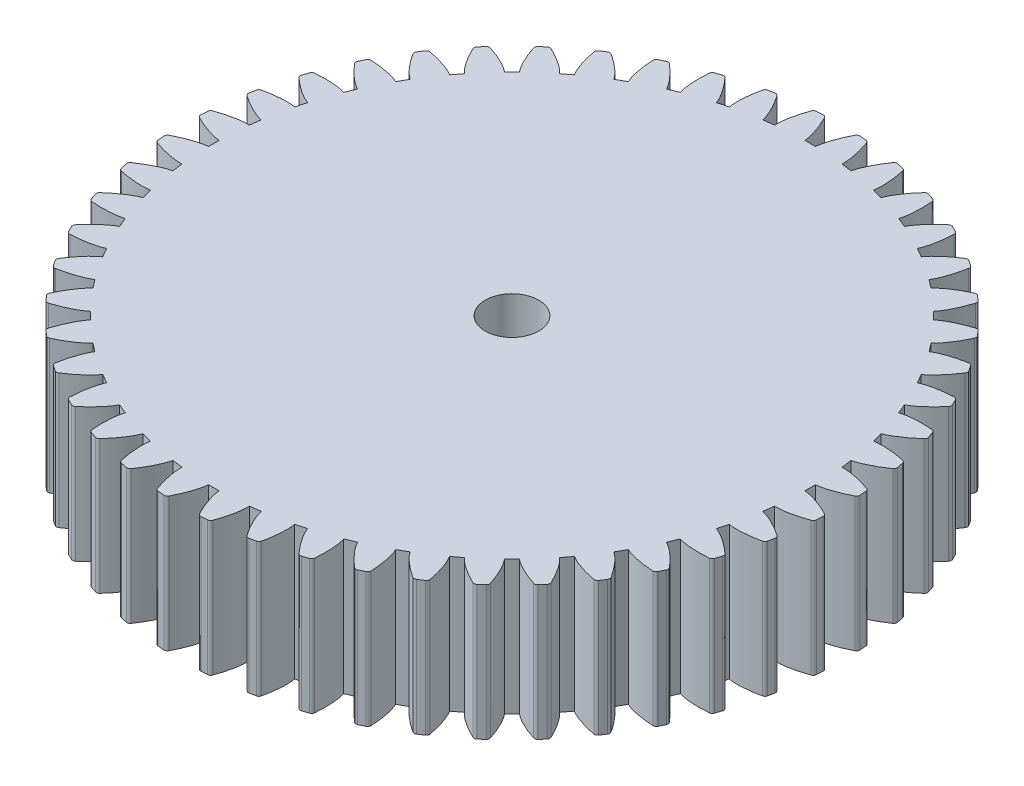
from build123d import *

# Parameters (mm, degrees)
SKETCH1_R                = 25.019
BOSS_EXTRUDE1_DEPTH      = 10.16
SKETCH2_R                = 2.032
CUT_EXTRUDE1_DEPTH       = 37.812040449
CUT_EXTRUDE2_DEPTH       = 37.812040449
FILLET1_R                = 0.254
CIRPATTERN1_COUNT        = 48
FILLET1_OF_CIRPATTERN1_R = 0.254


with BuildPart() as part:
    # Sketch1 → Boss-Extrude1 (new body)
    with BuildSketch(Plane(origin=(0, 0, 0), x_dir=(1, 0, 0), z_dir=(0, 1, 0))):
        Circle(SKETCH1_R)
    extrude(amount=BOSS_EXTRUDE1_DEPTH)

    # Sketch2 → Cut-Extrude1 (cut, through all)
    with BuildSketch(Plane(origin=(0, 10.16, 0), x_dir=(1, 0, 0), z_dir=(0, 1, 0))):
        Circle(SKETCH2_R)
    extrude(amount=-CUT_EXTRUDE1_DEPTH, mode=Mode.SUBTRACT)

    # Sketch3 → Cut-Extrude2 (cut, through all)
    with BuildSketch(Plane(origin=(0, 10.16, 0), x_dir=(1, 0, 0), z_dir=(0, 1, 0))):
        with BuildLine():
            Line((25.022135883, 1.25021561), (25.022135883, -1.25021561))
            add(Edge.make_bspline(
                [(22.602410583, -0.402829796), (22.606224346, -0.402936379), (22.616918633, -0.403354885), (22.637127056, -0.404618301), (22.670086825, -0.407350732), (22.712058202, -0.411818663), (22.766274811, -0.41872655), (22.830096935, -0.4283219), (22.900182603, -0.440394694), (22.976369557, -0.455178964), (23.052316043, -0.471387574), (23.128014647, -0.488915253), (23.203363021, -0.507601354), (23.294558326, -0.531685556), (23.40380098, -0.562579593), (23.531315684, -0.601627487), (23.675721078, -0.649381289), (23.822648625, -0.701761924), (23.967016654, -0.756354714), (24.112625727, -0.815023958), (24.253328245, -0.87427663), (24.399197404, -0.939422303), (24.533700679, -1.00138511), (24.684069967, -1.074794229), (24.805325575, -1.135199713), (24.930302693, -1.200927184), (24.991088327, -1.233408539), (25.022135883, -1.25021561)],
                knots=[0, 0, 0, 0, 0, 0.005376749, 0.015083688, 0.02853182, 0.04661014, 0.064854849, 0.092110526, 0.119476176, 0.146842496, 0.174208854, 0.201574956, 0.228941013, 0.256307345, 0.307035032, 0.361767352, 0.416499661, 0.471231937, 0.525964282, 0.580696616, 0.635428982, 0.690161387, 0.744893688, 0.799626082, 0.854358407, 0.909090914, 0.909090914, 0.909090914, 0.909090914, 0.909090914], degree=4))
            ThreePointArc((22.602410583, -0.402829796), (22.606, 0), (22.602410583, 0.402829796))
            add(Edge.make_bspline(
                [(22.602410583, 0.402829796), (22.606224346, 0.402936379), (22.616918633, 0.403354885), (22.637127056, 0.404618301), (22.670086825, 0.407350732), (22.712058202, 0.411818663), (22.766274811, 0.41872655), (22.830096935, 0.4283219), (22.900182603, 0.440394694), (22.976369557, 0.455178964), (23.052316043, 0.471387574), (23.128014647, 0.488915253), (23.203363021, 0.507601354), (23.294558326, 0.531685556), (23.40380098, 0.562579593), (23.531315684, 0.601627487), (23.675721078, 0.649381289), (23.822648625, 0.701761924), (23.967016654, 0.756354714), (24.112625727, 0.815023958), (24.253328245, 0.87427663), (24.399197404, 0.939422303), (24.533700679, 1.00138511), (24.684069967, 1.074794229), (24.805325575, 1.135199713), (24.930302693, 1.200927184), (24.991088327, 1.233408539), (25.022135883, 1.25021561)],
                knots=[0, 0, 0, 0, 0, 0.005376749, 0.015083688, 0.02853182, 0.04661014, 0.064854849, 0.092110526, 0.119476176, 0.146842496, 0.174208854, 0.201574956, 0.228941013, 0.256307345, 0.307035032, 0.361767352, 0.416499661, 0.471231937, 0.525964282, 0.580696616, 0.635428982, 0.690161387, 0.744893688, 0.799626082, 0.854358407, 0.909090914, 0.909090914, 0.909090914, 0.909090914, 0.909090914], degree=4))
        make_face()
    cut_extrude2 = extrude(amount=-CUT_EXTRUDE2_DEPTH, mode=Mode.SUBTRACT)

    # Fillet1
    fillet1_edges = [part.edges().sort_by_distance(p)[0] for p in [
        (24.98863954, 5.08, 1.232174889),
        (24.98863954, 5.08, -1.232174889),
    ]]
    fillet(fillet1_edges, radius=FILLET1_R)

    # CirPattern1: Cut-Extrude2 ×48 about axis
    cirpattern1_axis = Axis((0, 10.16, 0), (0, 1, 0))
    for i in range(1, CIRPATTERN1_COUNT):
        add(cut_extrude2.rotate(cirpattern1_axis, i * 360 / CIRPATTERN1_COUNT), mode=Mode.SUBTRACT)

    # Fillet1 of CirPattern1
    fillet1_of_cirpattern1_edges = [part.edges().sort_by_distance(p)[0] for p in [
        (24.935689361, 5.08, -2.040038506),
        (24.614027168, 5.08, -4.483305429),
        (24.456082623, 5.08, -5.277346277),
        (23.818261967, 5.08, -7.657725371),
        (23.558025532, 5.08, -8.424357189),
        (22.6149597, 5.08, -10.701119509),
        (22.256884092, 5.08, -11.427225014),
        (21.024709203, 5.08, -13.561414525),
        (20.574921194, 5.08, -14.234569852),
        (19.074720102, 5.08, -16.189669979),
        (18.54091569, 5.08, -16.798357252),
        (16.798357252, 5.08, -18.54091569),
        (16.189669979, 5.08, -19.074720102),
        (14.234569852, 5.08, -20.574921194),
        (13.561414525, 5.08, -21.024709203),
        (11.427225014, 5.08, -22.256884092),
        (10.701119509, 5.08, -22.6149597),
        (8.424357189, 5.08, -23.558025532),
        (7.657725371, 5.08, -23.818261967),
        (5.277346277, 5.08, -24.456082623),
        (4.483305429, 5.08, -24.614027168),
        (2.040038506, 5.08, -24.935689361),
        (1.232174889, 5.08, -24.98863954),
        (-1.232174889, 5.08, -24.98863954),
        (-2.040038506, 5.08, -24.935689361),
        (-4.483305429, 5.08, -24.614027168),
        (-5.277346277, 5.08, -24.456082623),
        (-7.657725371, 5.08, -23.818261967),
        (-8.424357189, 5.08, -23.558025532),
        (-10.701119509, 5.08, -22.6149597),
        (-11.427225014, 5.08, -22.256884092),
        (-13.561414525, 5.08, -21.024709203),
        (-14.234569852, 5.08, -20.574921194),
        (-16.189669979, 5.08, -19.074720102),
        (-16.798357252, 5.08, -18.54091569),
        (-18.54091569, 5.08, -16.798357252),
        (-19.074720102, 5.08, -16.189669979),
        (-20.574921194, 5.08, -14.234569852),
        (-21.024709203, 5.08, -13.561414525),
        (-22.256884092, 5.08, -11.427225014),
        (-22.6149597, 5.08, -10.701119509),
        (-23.558025532, 5.08, -8.424357189),
        (-23.818261967, 5.08, -7.657725371),
        (-24.456082623, 5.08, -5.277346277),
        (-24.614027168, 5.08, -4.483305429),
        (-24.935689361, 5.08, -2.040038506),
        (-24.98863954, 5.08, -1.232174889),
        (-24.98863954, 5.08, 1.232174889),
        (-24.935689361, 5.08, 2.040038506),
        (-24.614027168, 5.08, 4.483305429),
        (-24.456082623, 5.08, 5.277346277),
        (-23.818261967, 5.08, 7.657725371),
        (-23.558025532, 5.08, 8.424357189),
        (-22.6149597, 5.08, 10.701119509),
        (-22.256884092, 5.08, 11.427225014),
        (-21.024709203, 5.08, 13.561414525),
        (-20.574921194, 5.08, 14.234569852),
        (-19.074720102, 5.08, 16.189669979),
        (-18.54091569, 5.08, 16.798357252),
        (-16.798357252, 5.08, 18.54091569),
        (-16.189669979, 5.08, 19.074720102),
        (-14.234569852, 5.08, 20.574921194),
        (-13.561414525, 5.08, 21.024709203),
        (-11.427225014, 5.08, 22.256884092),
        (-10.701119509, 5.08, 22.6149597),
        (-8.424357189, 5.08, 23.558025532),
        (-7.657725371, 5.08, 23.818261967),
        (-5.277346277, 5.08, 24.456082623),
        (-4.483305429, 5.08, 24.614027168),
        (-2.040038506, 5.08, 24.935689361),
        (-1.232174889, 5.08, 24.98863954),
        (1.232174889, 5.08, 24.98863954),
        (2.040038506, 5.08, 24.935689361),
        (4.483305429, 5.08, 24.614027168),
        (5.277346277, 5.08, 24.456082623),
        (7.657725371, 5.08, 23.818261967),
        (8.424357189, 5.08, 23.558025532),
        (10.701119509, 5.08, 22.6149597),
        (11.427225014, 5.08, 22.256884092),
        (13.561414525, 5.08, 21.024709203),
        (14.234569852, 5.08, 20.574921194),
        (16.189669979, 5.08, 19.074720102),
        (16.798357252, 5.08, 18.54091569),
        (18.54091569, 5.08, 16.798357252),
        (19.074720102, 5.08, 16.189669979),
        (20.574921194, 5.08, 14.234569852),
        (21.024709203, 5.08, 13.561414525),
        (22.256884092, 5.08, 11.427225014),
        (22.6149597, 5.08, 10.701119509),
        (23.558025532, 5.08, 8.424357189),
        (23.818261967, 5.08, 7.657725371),
        (24.456082623, 5.08, 5.277346277),
        (24.614027168, 5.08, 4.483305429),
        (24.935689361, 5.08, 2.040038506),
    ]]
    fillet(fillet1_of_cirpattern1_edges, radius=FILLET1_OF_CIRPATTERN1_R)


solid = part.part
